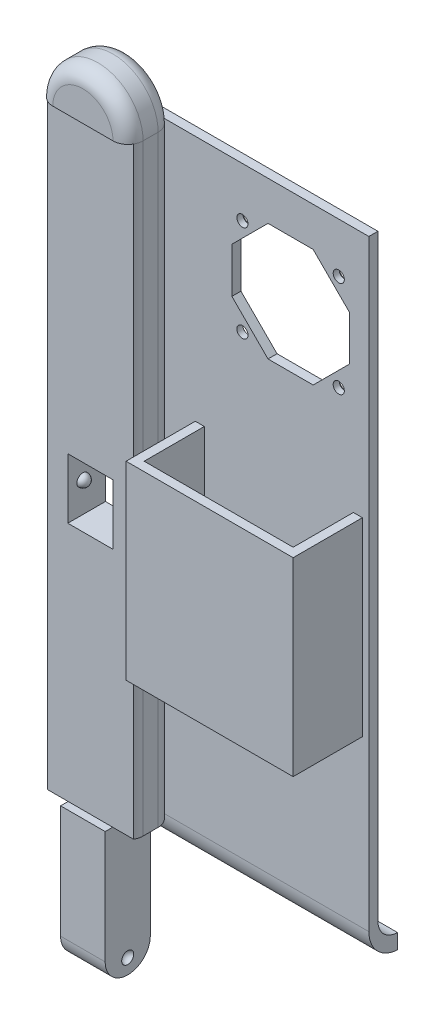
from build123d import *

# Parameters (mm, degrees)
BOSS_EXTRUDE1_DEPTH = 7.5
FILLET1_R           = 5
SKETCH4_W           = 15
SKETCH4_H           = 20
CUT_EXTRUDE1_DEPTH  = 152.492574085
CUT_EXTRUDE2_DEPTH  = 152.848641751
BOSS_EXTRUDE2_DEPTH = 80
BOSS_EXTRUDE3_START = 5
BOSS_EXTRUDE3_DEPTH = 5
SKETCH9_W           = 12.5
SKETCH9_H           = 20
CUT_EXTRUDE3_DEPTH  = 3
SKETCH10_W          = 2.5
SKETCH10_H          = 200
CUT_EXTRUDE4_DEPTH  = 175.180940404
SKETCH11_R          = 1.85
CUT_EXTRUDE5_DEPTH  = 167.580310961
SKETCH12_R          = 3
SKETCH12_R_2        = 3.25
CUT_EXTRUDE6_DEPTH  = 1
BOSS_EXTRUDE4_DEPTH = 170
SKETCH14_W          = 23
SKETCH14_H          = 81.987492178
SKETCH14_H_2        = 28.012507822
CUT_EXTRUDE7_DEPTH  = 56
SKETCH15_W          = 23
SKETCH15_H          = 3
BOSS_EXTRUDE5_DEPTH = 55.5


with BuildPart() as part:
    # Sketch1 → Boss-Extrude1 (new, symmetric)
    with BuildSketch(Plane.XY):
        with BuildLine():
            Line((-7.4, -150), (7.4, -150))
            Line((7.4, -150), (7.4, -100))
            Line((7.4, -100), (15, -100))
            Line((15, -100), (15, 100))
            ThreePointArc((15, 100), (0, 115), (-15, 100))
            Line((-15, 100), (-15, -100))
            Line((-15, -100), (-7.4, -100))
            Line((-7.4, -100), (-7.4, -150))
        make_face()
    extrude(amount=BOSS_EXTRUDE1_DEPTH, both=True)

    # Fillet1
    fillet1_edges = [part.edges().sort_by_distance(p)[0] for p in [
        (15, 0, -7.5),
        (0, 115, -7.5),
        (15, 0, 7.5),
        (0, 115, 7.5),
        (-7.4, -150, 0),
        (7.4, -150, 0),
        (-15, 0, -7.5),
        (-15, 0, 7.5),
    ]]
    fillet(fillet1_edges, radius=FILLET1_R)

    # Sketch4 → Cut-Extrude1 (cut, through all)
    with BuildSketch(Plane.XY.offset(7.5)):
        with Locations((0, -10)):
            Rectangle(SKETCH4_W, SKETCH4_H)
    extrude(amount=-CUT_EXTRUDE1_DEPTH, mode=Mode.SUBTRACT)

    # Sketch5 → Revolve2 (revolve)
    with BuildSketch(Plane.XY):
        with BuildLine():
            Line((-7.5, -10), (-5.5, -10))
            ThreePointArc((-5.5, -10), (-6.085786438, -8.585786438), (-7.5, -8))
            Line((-7.5, -8), (-7.5, -10))
        make_face()
        with BuildLine():
            Line((7.5, -10), (5.5, -10))
            ThreePointArc((5.5, -10), (6.085786438, -8.585786438), (7.5, -8))
            Line((7.5, -8), (7.5, -10))
        make_face()
    revolve(axis=Axis((-21.965922243, -10, 0), (1, 0, 0)))

    # Sketch2 → Cut-Revolve1 (revolve, cut)
    with BuildSketch(Plane.XY):
        with BuildLine():
            Line((-7.4, -138), (-7.4, -140))
            Line((-7.4, -140), (-5.4, -140))
            ThreePointArc((-5.4, -140), (-5.985786438, -138.585786438), (-7.4, -138))
        make_face()
        with BuildLine():
            Line((7.4, -138), (7.4, -140))
            Line((7.4, -140), (5.4, -140))
            ThreePointArc((5.4, -140), (5.985786438, -138.585786438), (7.4, -138))
        make_face()
    revolve(axis=Axis((-23.291382295, -140, 0), (1, 0, 0)), mode=Mode.SUBTRACT)

    # Sketch6 → Cut-Extrude2 (cut, through all)
    with BuildSketch(Plane.ZY.offset(7.4)):
        with BuildLine():
            Line((-7.5, -137.5), (-7.5, -150))
            Line((-7.5, -150), (7.5, -150))
            Line((7.5, -150), (7.5, -137.5))
            ThreePointArc((7.5, -137.5), (0, -145), (-7.5, -137.5))
        make_face()
    extrude(amount=-CUT_EXTRUDE2_DEPTH, mode=Mode.SUBTRACT)

    # Sketch3 → Boss-Extrude2 (add)
    with BuildSketch(Plane(origin=(0, 0, 0), x_dir=(0, 0, -1), z_dir=(1, 0, 0))):
        with BuildLine():
            Line((17, -109.987492178), (17, -104.987492178))
            ThreePointArc((17, -104.987492178), (12.403805922, -103.083686255), (10.5, -98.487492178))
            Line((10.5, -98.487492178), (10.5, 100))
            Line((10.5, 100), (7.5, 100))
            Line((7.5, 100), (7.5, -100))
            ThreePointArc((7.5, -100), (10.254311627, -106.892024376), (17, -109.987492178))
        make_face()
    extrude(amount=BOSS_EXTRUDE2_DEPTH)

    # Sketch7 → Boss-Extrude3 (add)
    with BuildSketch(Plane.ZY.offset(BOSS_EXTRUDE3_START)):
        with BuildLine():
            Line((-10.5, 100), (-7.5, 100))
            Line((-7.5, 100), (-7.5, 0))
            Line((-7.5, 0), (-7.5, -20))
            Line((-7.5, -20), (-7.5, -100))
            ThreePointArc((-7.5, -100), (-10.254311627, -106.892024376), (-17, -109.987492178))
            Line((-17, -109.987492178), (-17, -104.987492178))
            ThreePointArc((-17, -104.987492178), (-12.403805922, -103.083686255), (-10.5, -98.487492178))
            Line((-10.5, -98.487492178), (-10.5, 100))
        make_face()
    extrude(amount=-BOSS_EXTRUDE3_DEPTH)

    # Sketch9 → Cut-Extrude3 (cut)
    with BuildSketch(Plane(origin=(0, 0, -10.5), x_dir=(-1, 0, 0), z_dir=(0, 0, -1))):
        with Locations((-1.25, -10)):
            Rectangle(SKETCH9_W, SKETCH9_H)
    extrude(amount=-CUT_EXTRUDE3_DEPTH, mode=Mode.SUBTRACT)

    # Sketch10 → Cut-Extrude4 (cut, through all)
    with BuildSketch(Plane.ZY.offset(15)):
        with Locations((6.25, 0)):
            Rectangle(SKETCH10_W, SKETCH10_H)
    extrude(amount=-CUT_EXTRUDE4_DEPTH, mode=Mode.SUBTRACT)

    # Sketch11 → Cut-Extrude5 (cut, through all)
    with BuildSketch(Plane(origin=(0, 0, -10.5), x_dir=(-1, 0, 0), z_dir=(0, 0, -1))):
        with Locations((-38, 83.512507822)):
            Circle(SKETCH11_R)
        with Locations((-38, 51.512507822)):
            Circle(SKETCH11_R)
        with Locations((-70, 83.512507822)):
            Circle(SKETCH11_R)
        with Locations((-70, 51.512507822)):
            Circle(SKETCH11_R)
        Polygon((-46.5, 87.012507822), (-61.5, 87.012507822), (-73.5, 75.012507822), (-73.5, 60.012507822), (-61.5, 48.012507822), (-46.5, 48.012507822), (-34.5, 60.012507822), (-34.5, 75.012507822), align=None)
    extrude(amount=-CUT_EXTRUDE5_DEPTH, mode=Mode.SUBTRACT)

    # Sketch12 → Cut-Extrude6 (cut)
    with BuildSketch(Plane(origin=(0, 0, -10.5), x_dir=(-1, 0, 0), z_dir=(0, 0, -1))):
        with Locations((-38, 83.512507822)):
            Circle(SKETCH12_R)
        with Locations((-70, 83.512507822)):
            Circle(SKETCH12_R)
        with Locations((-70, 51.512507822)):
            Circle(SKETCH12_R)
        with Locations((-38, 51.512507822)):
            Circle(SKETCH12_R_2)
    extrude(amount=-CUT_EXTRUDE6_DEPTH, mode=Mode.SUBTRACT)

    # Sketch13 → Boss-Extrude4 (add)
    with BuildSketch(Plane(origin=(0, 100, 0), x_dir=(1, 0, 0), z_dir=(0, 1, 0))):
        Polygon((25.35, 7.5), (25.35, -12.5), (74.85, -12.5), (74.85, 7.5), (77.85, 7.5), (77.85, -15.5), (22.35, -15.5), (22.35, 7.5), align=None)
    extrude(amount=-BOSS_EXTRUDE4_DEPTH)

    # Sketch14 → Cut-Extrude7 (cut)
    with BuildSketch(Plane(origin=(77.85, 0, 0), x_dir=(0, 0, -1), z_dir=(1, 0, 0))):
        with Locations((-4, 59.006253911)):
            Rectangle(SKETCH14_W, SKETCH14_H)
        with Locations((-4, -55.993746089)):
            Rectangle(SKETCH14_W, SKETCH14_H_2)
    extrude(amount=-CUT_EXTRUDE7_DEPTH, mode=Mode.SUBTRACT)

    # Sketch15 → Boss-Extrude5 (add)
    with BuildSketch(Plane(origin=(77.85, 0, 0), x_dir=(0, 0, -1), z_dir=(1, 0, 0))):
        with Locations((-4, -43.487492178)):
            Rectangle(SKETCH15_W, SKETCH15_H)
    extrude(amount=-BOSS_EXTRUDE5_DEPTH)


solid = part.part
